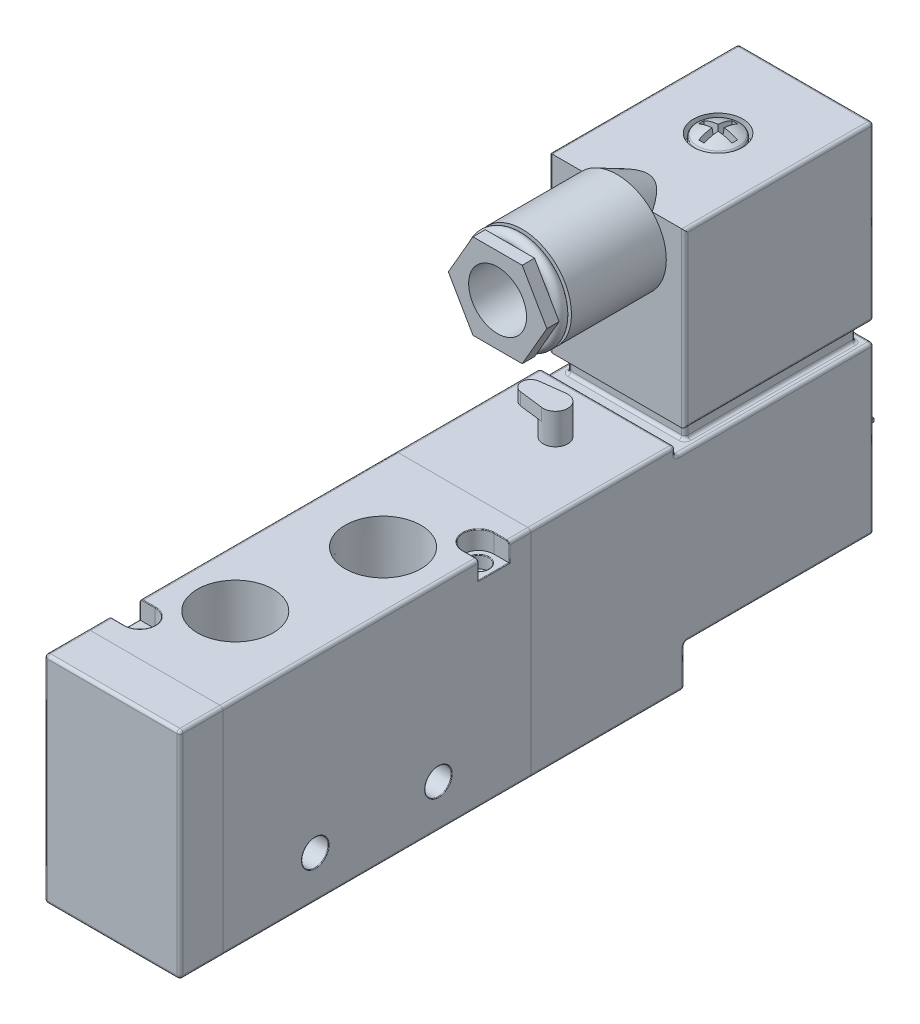
from build123d import *

# Parameters (mm, degrees)
EXTRUDE_1_DEPTH          = 32
EXTRUDE_1_DEPTH_BACK     = 50
SKETCH_1_W               = 22
SKETCH_1_H               = 35
SKETCH_3_R               = 2.15
CUT_EXTRUDE_1_DEPTH      = 10
CUT_EXTRUDE_3_DEPTH      = 3
SKETCH_6_R               = 2
EXTRUDE_2_DEPTH          = 5
EXTRUDE_START            = -2
EXTRUDE_3_DEPTH          = 2
SKETCH_9_W               = 22
SKETCH_9_H               = 28.5
EXTRUDE_4_DEPTH          = 30.7
EXTRUDE_8_DEPTH          = 3
SKETCH_25_R              = 0.75
EXTRUDE_9_DEPTH          = 4
SKETCH_10_R              = 5
EXTRUDE_5_DEPTH          = 2
EXTRUDE_6_DEPTH          = 3
EXTRUDE_6_DEPTH_BACK     = 1
SKETCH_11_R              = 6
SKETCH_12_R              = 2
CUT_EXTRUDE_5_DEPTH      = 3
PATTERN_CIRCULAR_1_COUNT = 10
SKETCH_13_W              = 22
SKETCH_13_H              = 30.7
EXTRUDE_7_DEPTH          = 58
SKETCH_15_R              = 11.967669101
CUT_EXTRUDE_6_DEPTH      = 2
SKETCH_16_W              = 3
SKETCH_16_H              = 3
SKETCH_18_R              = 4
CUT_EXTRUDE_7_DEPTH      = 2
FILLET_2_R               = 0.5
SKETCH_19_R              = 3.5
EXTRUDE_13930_DEPTH      = 1.75
CUT_EXTRUDE_START        = 3.15
CUT_EXTRUDE_14197_DEPTH  = 2.1
CUT_EXTRUDE_14197_DRAFT  = -5
FILLET_14578_R           = 0.35
SKETCH_27_R              = 6.1505
CUT_EXTRUDE_55_A_DEPTH   = 11
CUT_EXTRUDE_55_A_DRAFT   = -1.78
SKETCH_31_R              = 5.6
CUT_EXTRUDE_55_B_DEPTH   = 13.75
SKETCH_28_R              = 6.1505
CUT_EXTRUDE_55_A1_DEPTH  = 11
CUT_EXTRUDE_55_A1_DRAFT  = -1.78
SKETCH_32_R              = 5.6
CUT_EXTRUDE_55_B1_DEPTH  = 13.75
SKETCH_210_R             = 4.5735
CUT_EXTRUDE_55_A3_DEPTH  = 7.4
CUT_EXTRUDE_55_A3_DRAFT  = -1.78
SKETCH_34_R              = 4.2
CUT_EXTRUDE_55_B3_DEPTH  = 9.25
SKETCH_211_R             = 4.5735
CUT_EXTRUDE_55_A4_DEPTH  = 7.4
CUT_EXTRUDE_55_A4_DRAFT  = -1.78
SKETCH_35_R              = 4.2
CUT_EXTRUDE_55_B4_DEPTH  = 9.25
SKETCH_4_R               = 1.65
CUT_EXTRUDE_23_DEPTH     = 5
CUT_EXTRUDE_START_2      = -5
SKETCH_8_R               = 1.65
CUT_EXTRUDE_24_DEPTH     = 5
SKETCH_213_R             = 6.1505
CUT_EXTRUDE_55_A5_DEPTH  = 11
CUT_EXTRUDE_55_A5_DRAFT  = -1.78
SKETCH_36_R              = 5.6
CUT_EXTRUDE_55_B5_DEPTH  = 13.75
FILLET_4_R               = 0.1


# Read off the part's stored shape, not the designer's step: 圆顶-螺钉
with BuildPart() as part:
    # 草图1 → 凸台-拉伸1 (new, two sides: drawn at the far end of the back side and taken through both)
    with BuildSketch(Plane.XY.offset(-EXTRUDE_1_DEPTH_BACK)):
        Rectangle(SKETCH_1_W, SKETCH_1_H)
    extrude(amount=EXTRUDE_1_DEPTH + EXTRUDE_1_DEPTH_BACK)

    # 草图3 → 切除-拉伸1 (cut)
    with BuildSketch(Plane(origin=(11, 0, 0), x_dir=(0, 0, -1), z_dir=(1, 0, 0))):
        with Locations((-10, -10.5)):
            Circle(SKETCH_3_R)
        with Locations((10, -10.5)):
            Circle(SKETCH_3_R)
    extrude(amount=-CUT_EXTRUDE_1_DEPTH, mode=Mode.SUBTRACT)

    # 草图5 → 切除-拉伸3 (cut)
    with BuildSketch(Plane(origin=(0, 17.5, 0), x_dir=(1, 0, 0), z_dir=(0, 1, 0))):
        with BuildLine():
            Line((8.5, 21.5), (11, 21.5))
            Line((11, 21.5), (11, 16.5))
            Line((11, 16.5), (8.5, 16.5))
            ThreePointArc((8.5, 16.5), (6, 19), (8.5, 21.5))
        make_face()
        with BuildLine():
            Line((-8.5, -16.5), (-11, -16.5))
            Line((-11, -16.5), (-11, -21.5))
            Line((-11, -21.5), (-8.5, -21.5))
            ThreePointArc((-8.5, -21.5), (-6, -19), (-8.5, -16.5))
        make_face()
    extrude(amount=-CUT_EXTRUDE_3_DEPTH, mode=Mode.SUBTRACT)

    # 草图6 → 凸台-拉伸2 (add)
    with BuildSketch(Plane(origin=(0, 17.5, 0), x_dir=(1, 0, 0), z_dir=(0, 1, 0))):
        with Locations(Location((0, 40, 0), (0, 0, 90))):
            Circle(SKETCH_6_R)
    extrude(amount=EXTRUDE_2_DEPTH)

    # 草图7 → 凸台-拉伸3 (add)
    with BuildSketch(Plane(origin=(0, 22.5, 0), x_dir=(1, 0, 0), z_dir=(0, 1, 0)).offset(EXTRUDE_START)):
        with BuildLine():
            Line((-4.1875, 41.488235112), (-0.25, 41.984313483))
            ThreePointArc((-0.25, 41.984313483), (2, 40), (-0.25, 38.015686517))
            Line((-0.25, 38.015686517), (-4.1875, 38.511764888))
            ThreePointArc((-4.1875, 38.511764888), (-5.5, 40), (-4.1875, 41.488235112))
        make_face()
    extrude(amount=EXTRUDE_3_DEPTH)

    # 草图9 → 凸台-拉伸4 (add)
    with BuildSketch(Plane(origin=(0, 0, -50), x_dir=(-1, 0, 0), z_dir=(0, 0, -1))):
        with Locations((0, 3.25)):
            Rectangle(SKETCH_9_W, SKETCH_9_H)
    extrude(amount=EXTRUDE_4_DEPTH)

    # 草图24 → 凸台-拉伸8 (add)
    with BuildSketch(Plane(origin=(0, 17.5, 0), x_dir=(1, 0, 0), z_dir=(0, 1, 0))):
        with BuildLine():
            Line((-4, 68.2), (4, 68.2))
            ThreePointArc((4, 68.2), (4.707106781, 68.492893219), (5, 69.2))
            Line((5, 69.2), (5, 72.2))
            ThreePointArc((5, 72.2), (4.707106781, 72.907106781), (4, 73.2))
            Line((4, 73.2), (-4, 73.2))
            ThreePointArc((-4, 73.2), (-4.707106781, 72.907106781), (-5, 72.2))
            Line((-5, 72.2), (-5, 69.2))
            ThreePointArc((-5, 69.2), (-4.707106781, 68.492893219), (-4, 68.2))
        make_face()
    extrude(amount=EXTRUDE_8_DEPTH)

    # 草图25 → 凸台-拉伸9 (add)
    with BuildSketch(Plane(origin=(0, 20.5, 0), x_dir=(1, 0, 0), z_dir=(0, 1, 0))):
        with Locations(Location((-2, 70.7, 0), (0, 0, 90))):
            Circle(SKETCH_25_R)
        with Locations(Location((2, 70.7, 0), (0, 0, 90))):
            Circle(SKETCH_25_R)
    extrude(amount=EXTRUDE_9_DEPTH)

    # 草图10 → 凸台-拉伸5 (add)
    with BuildSketch(Plane(origin=(0, 0, -80.7), x_dir=(-1, 0, 0), z_dir=(0, 0, -1))):
        Circle(SKETCH_10_R)
    extrude(amount=EXTRUDE_5_DEPTH)

    # 草图11 → 凸台-拉伸6 (add, two sides: drawn at the far end of the back side and taken through both)
    with BuildSketch(Plane(origin=(0, 0, -82.7), x_dir=(-1, 0, 0), z_dir=(0, 0, -1)).offset(-EXTRUDE_6_DEPTH_BACK)):
        Circle(SKETCH_11_R)
    extrude(amount=EXTRUDE_6_DEPTH + EXTRUDE_6_DEPTH_BACK)

    # 草图12 → 切除-拉伸5 (cut)
    with BuildSketch(Plane(origin=(0, 0, -85.7), x_dir=(-1, 0, 0), z_dir=(0, 0, -1))):
        with Locations((0, 7)):
            Circle(SKETCH_12_R)
    cut_extrude_5 = extrude(amount=-CUT_EXTRUDE_5_DEPTH, mode=Mode.SUBTRACT)

    # 阵列(圆周)1: 切除-拉伸5 ×10 about axis
    pattern_circular_1_axis = Axis((0, 0, 0), (0, 0, 1))
    for i in range(1, PATTERN_CIRCULAR_1_COUNT):
        add(cut_extrude_5.rotate(pattern_circular_1_axis, i * 360 / PATTERN_CIRCULAR_1_COUNT), mode=Mode.SUBTRACT)

    # 草图13 → 凸台-拉伸7 (add)
    with BuildSketch(Plane.XZ.offset(11)):
        with Locations((0, -65.35)):
            Rectangle(SKETCH_13_W, SKETCH_13_H)
    extrude(amount=-EXTRUDE_7_DEPTH)

    # 草图14 → 旋转1 (revolve)
    with BuildSketch(Plane(origin=(0, 0, 0), x_dir=(0, 0, -1), z_dir=(1, 0, 0)), mode=Mode.PRIVATE) as revolve_1_sk:
        with BuildLine():
            Line((55, 47), (50, 49.4))
            Line((50, 49.4), (34.6, 49.4))
            Line((34.6, 49.4), (34.6, 48.4))
            ThreePointArc((34.6, 48.4), (33.6, 49.4), (32.6, 48.4))
            Line((32.6, 48.4), (32.6, 49.4))
            Line((32.6, 49.4), (30.6, 49.4))
            Line((30.6, 49.4), (30.6, 46.1))
            Line((30.6, 46.1), (40.6, 46.1))
            Line((40.6, 46.1), (40.6, 41.4))
            Line((40.6, 41.4), (55, 41.4))
            Line((55, 41.4), (55, 47))
        make_face()
    revolve(revolve_1_sk.sketch.rotate(Axis((0, 41.4, -40.6), (0, 0, -1)), 90), axis=Axis((0, 41.4, -40.6), (0, 0, -1)))

    # 草图15 → 切除-拉伸6 (cut)
    with BuildSketch(Plane.XY.offset(-30.6)):
        with Locations((0, 41.4)):
            Circle(SKETCH_15_R)
        Polygon((4, 48.32820323), (-4, 48.32820323), (-8, 41.4), (-4, 34.47179677), (4, 34.47179677), (8, 41.4), align=None, mode=Mode.SUBTRACT)
    extrude(amount=-CUT_EXTRUDE_6_DEPTH, mode=Mode.SUBTRACT)

    # 切除-扫描1: sweep along a path in 草图17
    with BuildLine(Plane(origin=(0, 17.5, 0), x_dir=(1, 0, 0), z_dir=(0, 1, 0))) as sweep_1_path:
        Line((-11, 50), (11, 50))
        Line((11, 50), (11, 80.7))
        Line((11, 80.7), (-11, 80.7))
        Line((-11, 80.7), (-11, 50))
    # 草图16 → 切除-扫描1 (sweep, cut)
    with BuildSketch(Plane(origin=(11, 0, 0), x_dir=(0, 0, -1), z_dir=(1, 0, 0))):
        with Locations((50, 17.5)):
            Rectangle(SKETCH_16_W, SKETCH_16_H)
    sweep(path=sweep_1_path.line, transition=Transition.RIGHT, mode=Mode.SUBTRACT)

    # 草图18 → 切除-拉伸7 (cut)
    with BuildSketch(Plane(origin=(0, 47, 0), x_dir=(1, 0, 0), z_dir=(0, 1, 0))):
        with Locations(Location((0, 66.407700653, 0), (0, 0, 270))):
            Circle(SKETCH_18_R)
    extrude(amount=-CUT_EXTRUDE_7_DEPTH, mode=Mode.SUBTRACT)

    # 圆角2
    fillet_2_edges = [part.edges().sort_by_distance(p)[0] for p in [
        (-11, 0, 32),
        (11, -14.25, -50),
        (0, -17.5, -50),
        (0, -17.5, 32),
        (11, 47, -65.35),
        (11, 33, -50),
        (0, 47, -80.7),
        (-11, 47, -65.35),
        (-11, 33, -50),
        (-11, 33, -80.7),
        (-11, 19, -65.35),
        (-11, 16.75, -48.5),
        (-11, 16, -64.6),
        (11, 2.5, -80.7),
        (0, 16, -51.5),
        (11, 16, -64.6),
        (0, 16, -48.5),
        (11, 16.75, -48.5),
        (0, 17.5, -48.5),
        (-9.5, 19, -65.35),
        (0, 19, -79.2),
        (9.5, 19, -65.35),
        (11, 19, -65.35),
        (9.5, 16, -65.35),
        (0, 16, -79.2),
        (9.5, 17.5, -79.2),
        (-9.5, 17.5, -79.2),
        (-9.5, 16, -65.35),
        (0, 16, -80.7),
        (0, 19, -80.7),
        (-9.5, 17.5, -51.5),
        (0, 19, -51.5),
        (9.5, 17.5, -51.5),
        (11, 17.5, -35),
        (11, 17.5, 7.75),
        (11, -17.5, -9),
        (-11, 17.5, 26.75),
        (-11, -17.5, -9),
        (11, -17.5, -9),
        (11, 17.5, -35),
        (-11, 17.5, -16),
        (-11, -17.5, -9),
        (11, 0, 32),
        (-11, 17.5, -16),
        (0, 17.5, 32),
        (11, -17.5, -9),
        (-11, -17.5, -9),
        (-11, 17.5, 26.75),
        (11, 17.5, 7.75),
        (-11, -14.25, -50),
        (0, -11, -50),
        (11, -11, -65.35),
        (-11, -11, -65.35),
        (11, 33, -80.7),
        (0, -11, -80.7),
        (-11, 2.5, -80.7),
    ]]
    fillet(fillet_2_edges, radius=FILLET_2_R)

    # 草图19 → Extrude 13930 (add)
    with BuildSketch(Plane(origin=(6.233876525, 45, -66.504349902), x_dir=(-1, 0, 0), z_dir=(0, 1, 0))):
        with Locations(Location((6.233876525, 0.096649248, 0), (0, 0, 90))):
            Circle(SKETCH_19_R)
    extrude(amount=EXTRUDE_13930_DEPTH)

    # Dome 13992 outline → Dome 13992 (revolve)
    with BuildSketch(Plane.XY.offset(-66.407700653)):
        with BuildLine():
            Line((0, 46.75), (3.500000005, 46.749999997))
            ThreePointArc((3.500000005, 46.749999997), (1.827053642, 47.531845463), (0, 47.8))
            Line((0, 47.8), (0, 46.75))
        make_face()
    revolve(axis=Axis((0, 0, -66.407700653), (0, 1, 0)))


with BuildPart() as cut_extrude_14197_tool:
    # 草图41 → Cut-Extrude 14197 (with draft: the straight prism first)
    with BuildSketch(Plane(origin=(6.233876525, 45, -66.504349902), x_dir=(-1, 0, 0), z_dir=(0, 1, 0)).offset(CUT_EXTRUDE_START)):
        Polygon((6.758876525, -0.428350752), (9.033876525, -0.428350752), (9.033876525, 0.621649248), (6.758876525, 0.621649248), (6.758876525, 2.896649248), (5.708876525, 2.896649248), (5.708876525, 0.621649248), (3.433876525, 0.621649248), (3.433876525, -0.428350752), (5.708876525, -0.428350752), (5.708876525, -2.703350752), (6.758876525, -2.703350752), align=None)
    extrude(amount=-CUT_EXTRUDE_14197_DEPTH)
    # Cut-Extrude 14197: the draft: its side faces are tilted about the plane it starts from
    cut_extrude_14197_sides = [cut_extrude_14197_tool.faces().sort_by_distance(p)[0] for p in [
        (-1.6625, 47.1, -66.932700653),
        (-2.8, 47.1, -66.407700653),
        (-1.6625, 47.1, -65.882700653),
        (-0.525, 47.1, -64.745200653),
        (0, 47.1, -63.607700653),
        (0.525, 47.1, -64.745200653),
        (1.6625, 47.1, -65.882700653),
        (2.8, 47.1, -66.407700653),
        (1.6625, 47.1, -66.932700653),
        (0.525, 47.1, -68.070200653),
        (0, 47.1, -69.207700653),
        (-0.525, 47.1, -68.070200653),
    ]]
    draft(cut_extrude_14197_sides, Plane(origin=(6.233876525, 45, -66.504349902), x_dir=(-1, 0, 0), z_dir=(0, 1, 0)).offset(CUT_EXTRUDE_START), CUT_EXTRUDE_14197_DRAFT)


with BuildPart() as part_1:
    add(part.part)

    # Cut-Extrude 14197: cut by cut_extrude_14197_tool
    add(cut_extrude_14197_tool.part, mode=Mode.SUBTRACT)

    # Fillet 14578
    fillet_14578_edges = [part_1.edges().sort_by_distance(p)[0] for p in [
        (-2.474873734, 46.75, -68.882574388),
    ]]
    fillet(fillet_14578_edges, radius=FILLET_14578_R)


with BuildPart() as cut_extrude_55_a_tool:
    # 草图27 → 55°管螺纹a (with draft: the straight prism first)
    with BuildSketch(Plane(origin=(3.972547317, 17.5, 1.731421807), x_dir=(1, 0, 0), z_dir=(0, 1, 0))):
        with Locations((-5.472547317, -8.768578193)):
            Circle(SKETCH_27_R)
    extrude(amount=-CUT_EXTRUDE_55_A_DEPTH)
    # 55°管螺纹a: the draft: its side faces are tilted about the plane it starts from
    cut_extrude_55_a_sides = [cut_extrude_55_a_tool.faces().sort_by_distance(p)[0] for p in [
        (-7.6505, 12, 10.5),
    ]]
    draft(cut_extrude_55_a_sides, Plane(origin=(3.972547317, 17.5, 1.731421807), x_dir=(1, 0, 0), z_dir=(0, 1, 0)), CUT_EXTRUDE_55_A_DRAFT)


with BuildPart() as part_2:
    add(part_1.part)

    # 55°管螺纹a: cut by cut_extrude_55_a_tool
    add(cut_extrude_55_a_tool.part, mode=Mode.SUBTRACT)

    # 草图31 → 55°管螺纹b (cut)
    with BuildSketch(Plane(origin=(3.972547317, 17.5, 1.731421807), x_dir=(-1, 0, 0), z_dir=(0, 1, 0))):
        with Locations(Location((5.472547317, 8.768578193, 0), (0, 0, 90))):
            Circle(SKETCH_31_R)
    extrude(amount=-CUT_EXTRUDE_55_B_DEPTH, mode=Mode.SUBTRACT)

    # 55°管螺纹c cone 1 section (through the dimple's axis) → 55°管螺纹c (revolve, cut)
    with BuildSketch(Plane(origin=(-1.5, 3.75, 10.5), x_dir=(0, 0, 1), z_dir=(1, 0, 0))):
        Polygon((0, 0), (5.6, 0), (0, 3.364819467), align=None)
    revolve(axis=Axis((-1.5, 3.75, 10.5), (0, -1, 0)), mode=Mode.SUBTRACT)


with BuildPart() as cut_extrude_55_a1_tool:
    # 草图28 → 55°管螺纹a1 (with draft: the straight prism first)
    with BuildSketch(Plane(origin=(-0.675072759, 17.5, -1.212735674), x_dir=(1, 0, 0), z_dir=(0, 1, 0))):
        with Locations((2.175072759, 9.287264326)):
            Circle(SKETCH_28_R)
    extrude(amount=-CUT_EXTRUDE_55_A1_DEPTH)
    # 55°管螺纹a1: the draft: its side faces are tilted about the plane it starts from
    cut_extrude_55_a1_sides = [cut_extrude_55_a1_tool.faces().sort_by_distance(p)[0] for p in [
        (-4.6505, 12, -10.5),
    ]]
    draft(cut_extrude_55_a1_sides, Plane(origin=(-0.675072759, 17.5, -1.212735674), x_dir=(1, 0, 0), z_dir=(0, 1, 0)), CUT_EXTRUDE_55_A1_DRAFT)


with BuildPart() as part_3:
    add(part_2.part)

    # 55°管螺纹a1: cut by cut_extrude_55_a1_tool
    add(cut_extrude_55_a1_tool.part, mode=Mode.SUBTRACT)

    # 草图32 → 55°管螺纹b1 (cut)
    with BuildSketch(Plane(origin=(-0.675072759, 17.5, -1.212735674), x_dir=(-1, 0, 0), z_dir=(0, 1, 0))):
        with Locations(Location((-2.175072759, -9.287264326, 0), (0, 0, 90))):
            Circle(SKETCH_32_R)
    extrude(amount=-CUT_EXTRUDE_55_B1_DEPTH, mode=Mode.SUBTRACT)

    # 55°管螺纹c1 cone 1 section (through the dimple's axis) → 55°管螺纹c1 (revolve, cut)
    with BuildSketch(Plane(origin=(1.5, 3.75, -10.5), x_dir=(0, 0, 1), z_dir=(1, 0, 0))):
        Polygon((0, 0), (5.6, 0), (0, 3.364819467), align=None)
    revolve(axis=Axis((1.5, 3.75, -10.5), (0, -1, 0)), mode=Mode.SUBTRACT)


with BuildPart() as cut_extrude_55_a3_tool:
    # 草图210 → 55°管螺纹a3 (with draft: the straight prism first)
    with BuildSketch(Plane(origin=(-0.800165437, -17.5, 9.857101759), x_dir=(-1, 0, 0), z_dir=(0, -1, 0))):
        with Locations((-0.800165437, -8.142898241)):
            Circle(SKETCH_210_R)
    extrude(amount=-CUT_EXTRUDE_55_A3_DEPTH)
    # 55°管螺纹a3: the draft: its side faces are tilted about the plane it starts from
    cut_extrude_55_a3_sides = [cut_extrude_55_a3_tool.faces().sort_by_distance(p)[0] for p in [
        (4.5735, -13.8, 18),
    ]]
    draft(cut_extrude_55_a3_sides, Plane(origin=(-0.800165437, -17.5, 9.857101759), x_dir=(-1, 0, 0), z_dir=(0, -1, 0)), CUT_EXTRUDE_55_A3_DRAFT)


with BuildPart() as part_4:
    add(part_3.part)

    # 55°管螺纹a3: cut by cut_extrude_55_a3_tool
    add(cut_extrude_55_a3_tool.part, mode=Mode.SUBTRACT)

    # 草图34 → 55°管螺纹b3 (cut)
    with BuildSketch(Plane(origin=(-0.800165437, -17.5, 9.857101759), x_dir=(1, 0, 0), z_dir=(0, -1, 0))):
        with Locations(Location((0.800165437, 8.142898241, 0), (0, 0, 270))):
            Circle(SKETCH_34_R)
    extrude(amount=-CUT_EXTRUDE_55_B3_DEPTH, mode=Mode.SUBTRACT)

    # 55°管螺纹c3 cone 1 section (through the dimple's axis) → 55°管螺纹c3 (revolve, cut)
    with BuildSketch(Plane(origin=(0, -8.25, 18), x_dir=(0, 0, -1), z_dir=(1, 0, 0))):
        Polygon((0, 0), (4.2, 0), (0, 2.5236146), align=None)
    revolve(axis=Axis((0, -8.25, 18), (0, 1, 0)), mode=Mode.SUBTRACT)


with BuildPart() as cut_extrude_55_a4_tool:
    # 草图211 → 55°管螺纹a4 (with draft: the straight prism first)
    with BuildSketch(Plane(origin=(-8.066134292, -17.5, -21.710456447), x_dir=(-1, 0, 0), z_dir=(0, -1, 0))):
        with Locations((-8.066134292, -3.710456447)):
            Circle(SKETCH_211_R)
    extrude(amount=-CUT_EXTRUDE_55_A4_DEPTH)
    # 55°管螺纹a4: the draft: its side faces are tilted about the plane it starts from
    cut_extrude_55_a4_sides = [cut_extrude_55_a4_tool.faces().sort_by_distance(p)[0] for p in [
        (4.5735, -13.8, -18),
    ]]
    draft(cut_extrude_55_a4_sides, Plane(origin=(-8.066134292, -17.5, -21.710456447), x_dir=(-1, 0, 0), z_dir=(0, -1, 0)), CUT_EXTRUDE_55_A4_DRAFT)


with BuildPart() as part_5:
    add(part_4.part)

    # 55°管螺纹a4: cut by cut_extrude_55_a4_tool
    add(cut_extrude_55_a4_tool.part, mode=Mode.SUBTRACT)

    # 草图35 → 55°管螺纹b4 (cut)
    with BuildSketch(Plane(origin=(-8.066134292, -17.5, -21.710456447), x_dir=(1, 0, 0), z_dir=(0, -1, 0))):
        with Locations(Location((8.066134292, 3.710456447, 0), (0, 0, 270))):
            Circle(SKETCH_35_R)
    extrude(amount=-CUT_EXTRUDE_55_B4_DEPTH, mode=Mode.SUBTRACT)

    # 55°管螺纹c4 cone 1 section (through the dimple's axis) → 55°管螺纹c4 (revolve, cut)
    with BuildSketch(Plane(origin=(0, -8.25, -18), x_dir=(0, 0, -1), z_dir=(1, 0, 0))):
        Polygon((0, 0), (4.2, 0), (0, 2.5236146), align=None)
    revolve(axis=Axis((0, -8.25, -18), (0, 1, 0)), mode=Mode.SUBTRACT)

    # 草图4 → 切除-拉伸23 (cut)
    with BuildSketch(Plane(origin=(0, 17.5, 0), x_dir=(1, 0, 0), z_dir=(0, 1, 0))):
        with Locations(Location((8.5, 19, 0), (0, 0, 270))):
            Circle(SKETCH_4_R)
        with Locations(Location((-8.5, -19, 0), (0, 0, 270))):
            Circle(SKETCH_4_R)
    extrude(amount=-CUT_EXTRUDE_23_DEPTH, mode=Mode.SUBTRACT)

    # 草图8 → 切除-拉伸24 (cut)
    with BuildSketch(Plane.XZ.offset(17.5).offset(CUT_EXTRUDE_START_2)):
        with Locations(Location((-8.5, 19, 0), (0, 0, 90))):
            Circle(SKETCH_8_R)
        with Locations(Location((8.5, -19, 0), (0, 0, 90))):
            Circle(SKETCH_8_R)
    extrude(amount=CUT_EXTRUDE_24_DEPTH, mode=Mode.SUBTRACT)


with BuildPart() as cut_extrude_55_a5_tool:
    # 草图213 → 55°管螺纹a5 (with draft: the straight prism first)
    with BuildSketch(Plane(origin=(-7.507563078, -17.5, -9.98237159), x_dir=(-1, 0, 0), z_dir=(0, -1, 0))):
        with Locations((-7.507563078, -9.98237159)):
            Circle(SKETCH_213_R)
    extrude(amount=-CUT_EXTRUDE_55_A5_DEPTH)
    # 55°管螺纹a5: the draft: its side faces are tilted about the plane it starts from
    cut_extrude_55_a5_sides = [cut_extrude_55_a5_tool.faces().sort_by_distance(p)[0] for p in [
        (6.1505, -12, 0),
    ]]
    draft(cut_extrude_55_a5_sides, Plane(origin=(-7.507563078, -17.5, -9.98237159), x_dir=(-1, 0, 0), z_dir=(0, -1, 0)), CUT_EXTRUDE_55_A5_DRAFT)


with BuildPart() as part_6:
    add(part_5.part)

    # 55°管螺纹a5: cut by cut_extrude_55_a5_tool
    add(cut_extrude_55_a5_tool.part, mode=Mode.SUBTRACT)

    # 草图36 → 55°管螺纹b5 (cut)
    with BuildSketch(Plane(origin=(-7.507563078, -17.5, -9.98237159), x_dir=(1, 0, 0), z_dir=(0, -1, 0))):
        with Locations(Location((7.507563078, 9.98237159, 0), (0, 0, 270))):
            Circle(SKETCH_36_R)
    extrude(amount=-CUT_EXTRUDE_55_B5_DEPTH, mode=Mode.SUBTRACT)

    # 55°管螺纹c5 cone 1 section (through the dimple's axis) → 55°管螺纹c5 (revolve, cut)
    with BuildSketch(Plane(origin=(0, -3.75, 0), x_dir=(0, 0, -1), z_dir=(1, 0, 0))):
        Polygon((0, 0), (5.6, 0), (0, 3.364819467), align=None)
    revolve(axis=Axis((0, -3.75, 0), (0, 1, 0)), mode=Mode.SUBTRACT)

    # 圆角4
    fillet_4_edges = [part_6.edges().sort_by_distance(p)[0] for p in [
        (1, -10.5, 12.15),
        (11, -10.5, 12.15),
        (1, -10.5, -7.85),
        (11, -10.5, -7.85),
        (11, 14.5, -19),
        (11, 15.75, -21.5),
        (11, 15.75, -16.5),
        (6, 17.5, -19),
        (9.5, 17.5, -16.5),
        (-9.5, 17.5, 21.5),
        (9.5, 17.5, -21.5),
        (10.853553391, 17.353553391, -21.5),
        (-10.853553391, 17.353553391, 16.5),
        (10.853553391, 17.353553391, -16.5),
        (-10.853553391, 17.353553391, 21.5),
        (-11, 14.5, 19),
        (-11, 15.75, 21.5),
        (-11, 15.75, 16.5),
        (-6, 17.5, 19),
        (-9.5, 17.5, 16.5),
        (-8.5, 14.5, 17.35),
        (8.5, 14.5, -20.65),
        (-8.5, -12.5, 17.35),
        (-8.5, -17.5, 17.35),
        (8.5, -12.5, -20.65),
        (8.5, -17.5, -20.65),
    ]]
    fillet(fillet_4_edges, radius=FILLET_4_R)


solid = part_6.part
